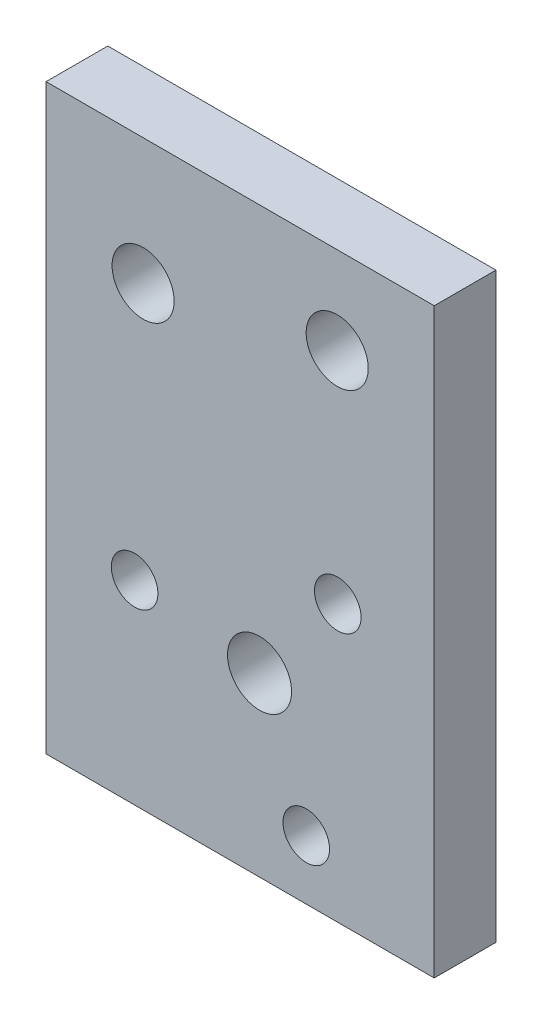
from build123d import *

# Parameters (mm, degrees)
SKETCH1_W           = 20
SKETCH1_H           = 30
SKETCH1_R           = 1.6
SKETCH1_R_2         = 1.2
SKETCH1_R_3         = 1.65
BOSS_EXTRUDE3_DEPTH = 3.18


with BuildPart() as part:
    # Sketch1 → Boss-Extrude3 (new body)
    with BuildSketch(Plane.XY):
        with Locations((10, 15)):
            Rectangle(SKETCH1_W, SKETCH1_H)
        with Locations((5, 23.5)):
            Circle(SKETCH1_R, mode=Mode.SUBTRACT)
        with Locations((15, 25.5)):
            Circle(SKETCH1_R, mode=Mode.SUBTRACT)
        with Locations((15.03, 14.204967623)):
            Circle(SKETCH1_R_2, mode=Mode.SUBTRACT)
        with Locations((13.407550623, 3.054802868)):
            Circle(SKETCH1_R_2, mode=Mode.SUBTRACT)
        with Locations((4.562449377, 10.034967623)):
            Circle(SKETCH1_R_2, mode=Mode.SUBTRACT)
        with Locations((11, 9.098246038)):
            Circle(SKETCH1_R_3, mode=Mode.SUBTRACT)
    extrude(amount=BOSS_EXTRUDE3_DEPTH)


solid = part.part
